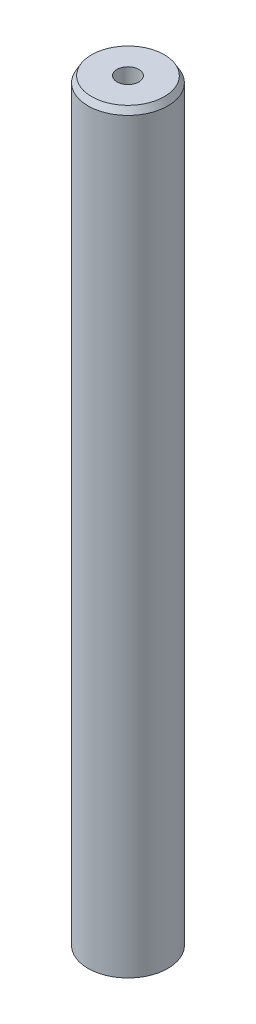
from build123d import *
from OCP.BRepFilletAPI import BRepFilletAPI_MakeChamfer

# Parameters (mm, degrees)
SKETCH1_R           = 5
BOSS_EXTRUDE1_DEPTH = 94.780660024
SKETCH2_R           = 1.369393398
CUT_EXTRUDE1_DEPTH  = 96.044060911
CHAMFER1_SIZE       = 0.779142926
CHAMFER1_SIZE2      = 0.449838378


with BuildPart() as part:
    # Sketch1 → Boss-Extrude1 (new body)
    with BuildSketch(Plane(origin=(0, 0, 0), x_dir=(1, 0, 0), z_dir=(0, 1, 0))):
        Circle(SKETCH1_R)
    extrude(amount=BOSS_EXTRUDE1_DEPTH)

    # Sketch2 → Cut-Extrude1 (cut, through all)
    with BuildSketch(Plane(origin=(0, 0, 0), x_dir=(1, 0, 0), z_dir=(0, 1, 0))):
        Circle(SKETCH2_R)
    extrude(amount=CUT_EXTRUDE1_DEPTH, mode=Mode.SUBTRACT)

    # Chamfer1: one chamfer whose edges measure the first distance from different faces: ONE call of the kernel's chamfer builder (chamfer() names one face for all edges)
    chamfer1_edges_1 = [part.edges().sort_by_distance(p)[0] for p in [
        (-5, 94.780660024, 0),
    ]]
    chamfer1_side_1 = [part.faces().sort_by_distance(p)[0] for p in [
        (-5, 47.390330012, 0),
    ]]
    chamfer1_edges_2 = [part.edges().sort_by_distance(p)[0] for p in [
        (-5, 0, 0),
    ]]
    chamfer1_side_2 = [part.faces().sort_by_distance(p)[0] for p in [
        (-4.858578644, 0, 0),
    ]]
    chamfer1 = BRepFilletAPI_MakeChamfer(part.part.solid().wrapped)
    for e in chamfer1_edges_1:
        chamfer1.Add(CHAMFER1_SIZE, CHAMFER1_SIZE2, e.wrapped, chamfer1_side_1[0].wrapped)  # the first distance lies on this face
    for e in chamfer1_edges_2:
        chamfer1.Add(CHAMFER1_SIZE, CHAMFER1_SIZE2, e.wrapped, chamfer1_side_2[0].wrapped)  # the first distance lies on this face
    add(Compound.cast(chamfer1.Shape()), mode=Mode.REPLACE)


solid = part.part
